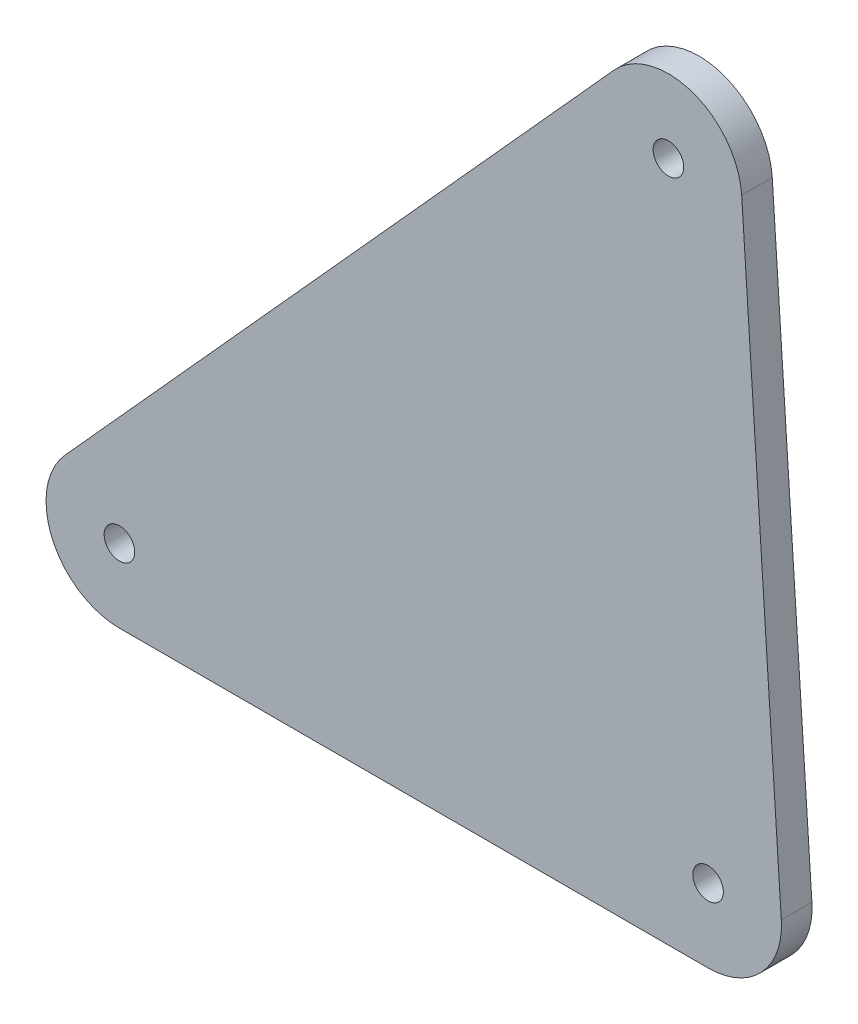
from build123d import *

# Parameters (mm, degrees)
SKETCH_1_R      = 2.5
EXTRUDE_1_DEPTH = 5


with BuildPart() as part:
    # 草图1 → 凸台-拉伸1 (new body)
    with BuildSketch(Plane.XY.offset(-18.206005243)):
        with BuildLine():
            Line((108.214557081, -42.91340116), (101.732163058, 56.475423815))
            ThreePointArc((101.732163058, 56.475423815), (93.699392778, 67.028534207), (80.851797136, 63.737208711))
            Line((80.851797136, 63.737208711), (-8.905808702, -35.651616247))
            ThreePointArc((-8.905808702, -35.651616247), (-10.966165116, -48.567114254), (0, -55.694412478))
            Line((0, -55.694412478), (96.239999844, -55.694412478))
            ThreePointArc((96.239999844, -55.694412478), (104.997058016, -51.898919293), (108.214557081, -42.91340116))
        make_face()
        with Locations((89.757605827, 55.694412486)):
            Circle(SKETCH_1_R, mode=Mode.SUBTRACT)
        with Locations((96.239999844, -43.694412489)):
            Circle(SKETCH_1_R, mode=Mode.SUBTRACT)
        with Locations((0, -43.694412482)):
            Circle(SKETCH_1_R, mode=Mode.SUBTRACT)
    extrude(amount=-EXTRUDE_1_DEPTH)


solid = part.part
